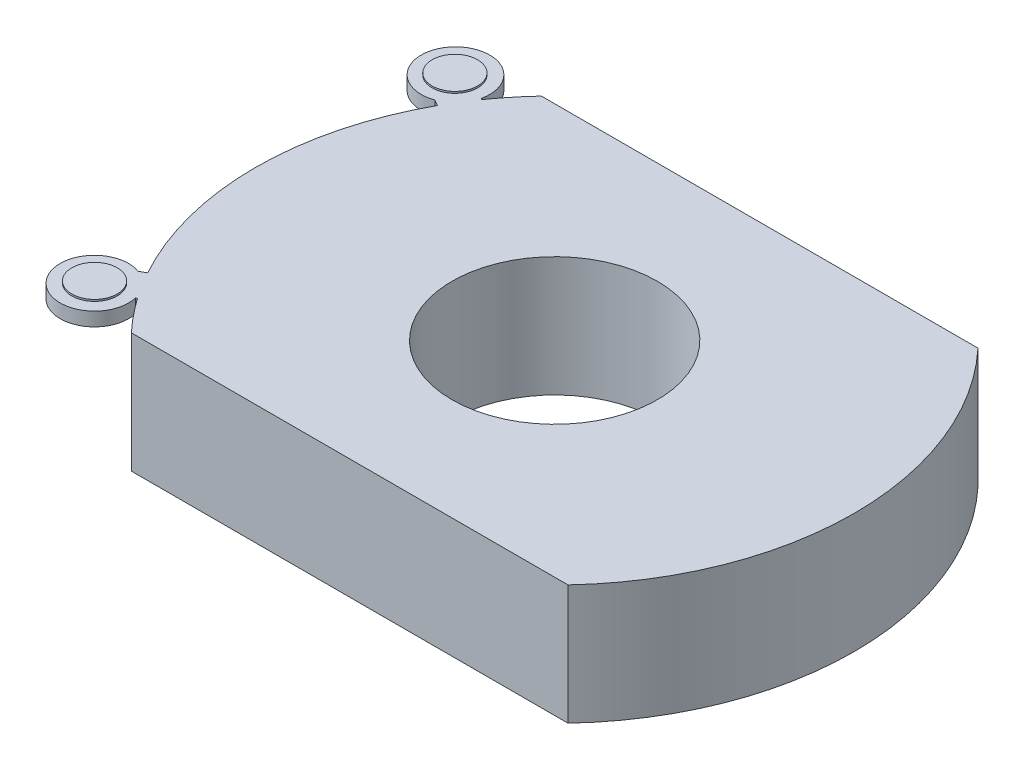
from build123d import *

# Parameters (mm, degrees)
SKETCH1_R                = 1750
BOSS_EXTRUDE1_DEPTH      = 700
CUT_EXTRUDE10_DEPTH      = 2572.964229922
CUT_EXTRUDE10_DEPTH_BACK = 2572.964229922
SKETCH9_W                = 5273.235769222
SKETCH9_H                = 4165.824449254
SKETCH9_W_2              = 4212.623718326
SKETCH9_H_2              = 2396.11984
CUT_EXTRUDE3_DEPTH       = 2234.348958831
CUT_EXTRUDE3_DEPTH_BACK  = 2234.348958831
SKETCH3_R                = 600
SHELL1_T                 = -1.5
BOSS_EXTRUDE2_START      = -80
BOSS_EXTRUDE2_DEPTH      = 80
SKETCH14_R               = 132.8125
BOSS_EXTRUDE5_DEPTH      = 10
SKETCH18_W               = 200
SKETCH18_H               = 200
SKETCH18_R               = 27.5
BOSS_EXTRUDE6_DEPTH      = 50


with BuildPart() as part:
    # Sketch1 → Boss-Extrude1 (new body)
    with BuildSketch(Plane(origin=(0, 0, 0), x_dir=(1, 0, 0), z_dir=(0, 1, 0))):
        Circle(SKETCH1_R)
    extrude(amount=BOSS_EXTRUDE1_DEPTH)

    # Sketch9 → Cut-Extrude10 (cut, two sides: drawn at the far end of the back side and taken through both)
    with BuildSketch(Plane.XZ.offset(-CUT_EXTRUDE10_DEPTH_BACK)):
        Rectangle(SKETCH9_W, SKETCH9_H)
        Rectangle(SKETCH9_W_2, SKETCH9_H_2, mode=Mode.SUBTRACT)
    extrude(amount=CUT_EXTRUDE10_DEPTH + CUT_EXTRUDE10_DEPTH_BACK, mode=Mode.SUBTRACT)

    # Sketch3 → Cut-Extrude3 (cut, two sides: drawn at the far end of the back side and taken through both)
    with BuildSketch(Plane.XZ.offset(-CUT_EXTRUDE3_DEPTH_BACK)):
        Circle(SKETCH3_R)
    extrude(amount=CUT_EXTRUDE3_DEPTH + CUT_EXTRUDE3_DEPTH_BACK, mode=Mode.SUBTRACT)

    # Shell1
    shell1_openings = [part.faces().sort_by_distance(p)[0] for p in [
        (1707.583740986, 0, 0),
    ]]
    offset(amount=SHELL1_T, openings=shell1_openings, kind=Kind.INTERSECTION)

    # Sketch12 → Boss-Extrude2 (add)
    with BuildSketch(Plane(origin=(0, 700, 0), x_dir=(1, 0, 0), z_dir=(0, 1, 0)).offset(BOSS_EXTRUDE2_START)):
        with BuildLine():
            Line((-1567.053683568, 866.753467227), (-1531.362261127, 847.012175352))
            ThreePointArc((-1531.362261127, 847.012175352), (-1483.854285491, 927.726500338), (-1432.096158714, 1005.78357125))
            Line((-1432.096158714, 1005.78357125), (-1439.594389916, 1011.04969651))
            ThreePointArc((-1439.594389916, 1011.04969651), (-1784.610239672, 1187.36643031), (-1567.053683568, 866.753467227))
        make_face()
        with BuildLine():
            Line((-1439.594389916, -1011.04969651), (-1432.096158714, -1005.78357125))
            ThreePointArc((-1432.096158714, -1005.78357125), (-1483.854285491, -927.726500338), (-1531.362261127, -847.012175352))
            Line((-1531.362261127, -847.012175352), (-1567.053683568, -866.753467227))
            ThreePointArc((-1567.053683568, -866.753467227), (-1784.610239672, -1187.36643031), (-1439.594389916, -1011.04969651))
        make_face()
    extrude(amount=BOSS_EXTRUDE2_DEPTH)

    # Sketch14 → Boss-Extrude5 (add)
    with BuildSketch(Plane(origin=(0, 700, 0), x_dir=(1, 0, 0), z_dir=(0, 1, 0))):
        with Locations((-1636.059482609, -1052.830646003)):
            Circle(SKETCH14_R)
        with Locations((-1636.059482609, 1052.830646003)):
            Circle(SKETCH14_R)
    extrude(amount=BOSS_EXTRUDE5_DEPTH)

    # Sketch18 → Boss-Extrude6 (add)
    with BuildSketch(Plane.XZ.offset(-698.5)):
        with Locations((-1178.70980988, 0)):
            Rectangle(SKETCH18_W, SKETCH18_H)
        with Locations((-1178.70980988, 0)):
            Circle(SKETCH18_R, mode=Mode.SUBTRACT)
    extrude(amount=BOSS_EXTRUDE6_DEPTH)


solid = part.part
